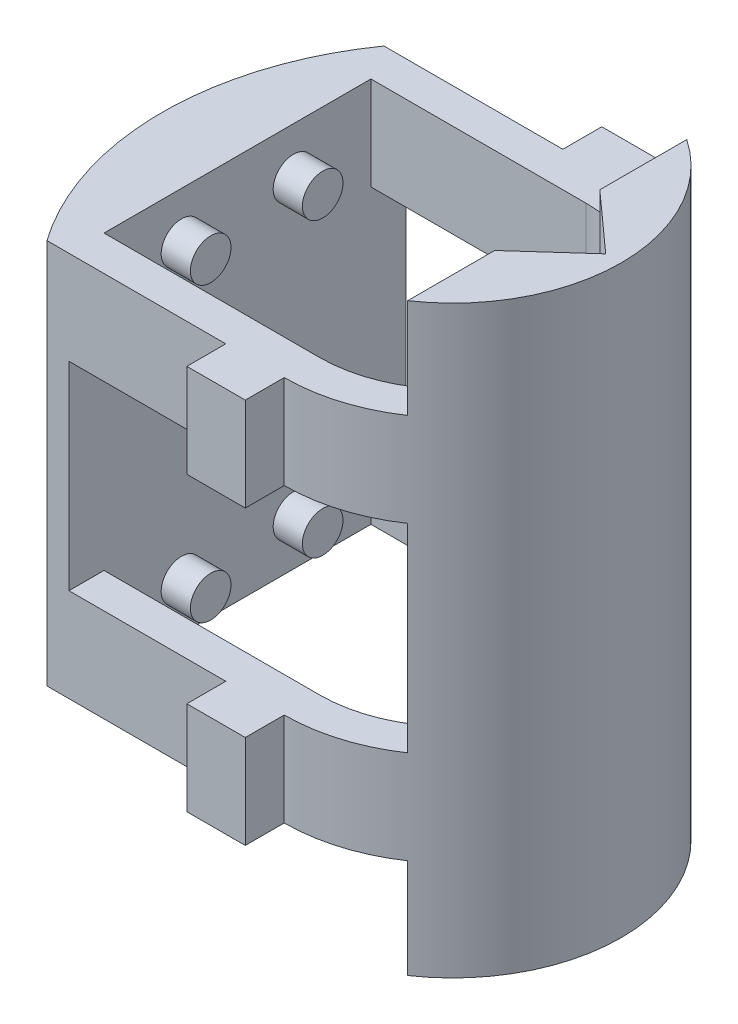
from build123d import *

# Parameters (mm, degrees)
BOSS_EXTRUDE1_START = 0.2
BOSS_EXTRUDE1_DEPTH = 9.6
BOSS_EXTRUDE2_START = -10
BOSS_EXTRUDE2_DEPTH = 30
MIRROR1_START       = 9.8
MIRROR1_DEPTH       = 30
MIRROR1_START_2     = 30.2
MIRROR1_2_DEPTH     = 9.6
MIRROR1_START_3     = 39.8
MIRROR1_3_DEPTH     = 10.2
MIRROR1_START_4     = -22.1
MIRROR1_4_OUTLINE_R = 2.085
MIRROR1_4_DEPTH     = 3


with BuildPart() as part:
    # Sketch1 → Boss-Extrude1 (new body)
    with BuildSketch(Plane(origin=(0, 0, 0), x_dir=(1, 0, 0), z_dir=(0, 1, 0)).offset(BOSS_EXTRUDE1_START)):
        with BuildLine():
            ThreePointArc((-24.36, 17.3), (-29.850614043, 0), (-24.36, -17.3))
            Line((-24.36, -17.3), (-6, -17.3))
            Line((-6, -17.3), (-6, -21.3))
            Line((-6, -21.3), (0, -21.3))
            Line((0, -21.3), (0, -17.3))
            ThreePointArc((0, -17.3), (17.3, 0), (0, 17.3))
            Line((0, 17.3), (0, 21.3))
            Line((0, 21.3), (-6, 21.3))
            Line((-6, 21.3), (-6, 17.3))
            Line((-6, 17.3), (-24.36, 17.3))
        make_face()
        with BuildLine():
            Line((0, -13.7), (-22.1, -13.7))
            Line((-22.1, -13.7), (-22.1, 13.7))
            Line((-22.1, 13.7), (0, 13.7))
            ThreePointArc((0, 13.7), (5.251022882, 12.653725091), (9.7, 9.674709298))
            Line((9.7, 9.674709298), (9.7, 5.4))
            Line((9.7, 5.4), (15.7, 0))
            Line((15.7, 0), (9.7, -5.4))
            Line((9.7, -5.4), (9.7, -9.674709298))
            ThreePointArc((9.7, -9.674709298), (5.251022882, -12.653725091), (0, -13.7))
        make_face(mode=Mode.SUBTRACT)
    extrude(amount=BOSS_EXTRUDE1_DEPTH)

    # Sketch1<3> → Boss-Extrude2 (add)
    with BuildSketch(Plane(origin=(0, 0, 0), x_dir=(1, 0, 0), z_dir=(0, 1, 0)).offset(BOSS_EXTRUDE2_START)):
        with BuildLine():
            Line((9.7, 14.324803664), (9.7, 9.674709298))
            ThreePointArc((9.7, 9.674709298), (12.261151879, 6.111804528), (13.564518925, 1.921932967))
            Line((13.564518925, 1.921932967), (15.7, 0))
            Line((15.7, 0), (13.564518925, -1.921932967))
            ThreePointArc((13.564518925, -1.921932967), (12.261151879, -6.111804528), (9.7, -9.674709298))
            Line((9.7, -9.674709298), (9.7, -14.324803664))
            ThreePointArc((9.7, -14.324803664), (17.3, 0), (9.7, 14.324803664))
        make_face()
        with BuildLine():
            Line((9.7, -5.4), (9.7, -9.674709298))
            ThreePointArc((9.7, -9.674709298), (12.261151879, -6.111804528), (13.564518925, -1.921932967))
            Line((13.564518925, -1.921932967), (9.7, -5.4))
        make_face()
        with BuildLine():
            ThreePointArc((13.564518925, 1.921932967), (12.261151879, 6.111804528), (9.7, 9.674709298))
            Line((9.7, 9.674709298), (9.7, 5.4))
            Line((9.7, 5.4), (13.564518925, 1.921932967))
        make_face()
    extrude(amount=BOSS_EXTRUDE2_DEPTH)

    # Mirror1: read off the stored shape, not the designer's step
    # Mirror1 outline → Mirror1 (add)
    with BuildSketch(Plane(origin=(0, 0, 0), x_dir=(1, 0, 0), z_dir=(0, 1, 0)).offset(MIRROR1_START)):
        with BuildLine():
            Line((-22.1, -17.3), (-22.1, 17.3))
            Line((-22.1, 17.3), (-24.36, 17.3))
            ThreePointArc((-24.36, 17.3), (-29.850614043, 0), (-24.36, -17.3))
            Line((-24.36, -17.3), (-22.1, -17.3))
        make_face()
        with BuildLine():
            Line((9.7, -5.4), (9.7, -14.324803664))
            ThreePointArc((9.7, -14.324803664), (17.3, 0), (9.7, 14.324803664))
            Line((9.7, 14.324803664), (9.7, 5.4))
            Line((9.7, 5.4), (15.7, 0))
            Line((15.7, 0), (9.7, -5.4))
        make_face()
    extrude(amount=MIRROR1_DEPTH)

    # Mirror1 2 outline → Mirror1 2 (add)
    with BuildSketch(Plane(origin=(0, 0, 0), x_dir=(1, 0, 0), z_dir=(0, 1, 0)).offset(MIRROR1_START_2)):
        with BuildLine():
            Line((0, -13.7), (-22.1, -13.7))
            Line((-22.1, -13.7), (-22.1, -17.3))
            Line((-22.1, -17.3), (-6, -17.3))
            Line((-6, -17.3), (-6, -21.3))
            Line((-6, -21.3), (0, -21.3))
            Line((0, -21.3), (0, -17.3))
            ThreePointArc((0, -17.3), (5.073011759, -16.539484626), (9.7, -14.324803664))
            Line((9.7, -14.324803664), (9.7, -9.674709298))
            ThreePointArc((9.7, -9.674709298), (5.251022882, -12.653725091), (0, -13.7))
        make_face()
        with BuildLine():
            Line((-22.1, 17.3), (-22.1, 13.7))
            Line((-22.1, 13.7), (0, 13.7))
            ThreePointArc((0, 13.7), (5.251022882, 12.653725091), (9.7, 9.674709298))
            Line((9.7, 9.674709298), (9.7, 14.324803664))
            ThreePointArc((9.7, 14.324803664), (5.073011759, 16.539484626), (0, 17.3))
            Line((0, 17.3), (0, 21.3))
            Line((0, 21.3), (-6, 21.3))
            Line((-6, 21.3), (-6, 17.3))
            Line((-6, 17.3), (-22.1, 17.3))
        make_face()
    extrude(amount=MIRROR1_2_DEPTH)

    # Mirror1 3 outline → Mirror1 3 (add)
    with BuildSketch(Plane(origin=(0, 0, 0), x_dir=(1, 0, 0), z_dir=(0, 1, 0)).offset(MIRROR1_START_3)):
        with BuildLine():
            Line((9.7, -5.4), (9.7, -14.324803664))
            ThreePointArc((9.7, -14.324803664), (17.3, 0), (9.7, 14.324803664))
            Line((9.7, 14.324803664), (9.7, 5.4))
            Line((9.7, 5.4), (15.7, 0))
            Line((15.7, 0), (9.7, -5.4))
        make_face()
    extrude(amount=MIRROR1_3_DEPTH)

    # Mirror1 4 outline → Mirror1 4 (add)
    with BuildSketch(Plane.YZ.offset(MIRROR1_START_4)):
        with Locations((5, 5.75)):
            Circle(MIRROR1_4_OUTLINE_R)
        with Locations((5, -5.75)):
            Circle(MIRROR1_4_OUTLINE_R)
        with Locations((35, 5.75)):
            Circle(MIRROR1_4_OUTLINE_R)
        with Locations((35, -5.75)):
            Circle(MIRROR1_4_OUTLINE_R)
    extrude(amount=MIRROR1_4_DEPTH)


solid = part.part
